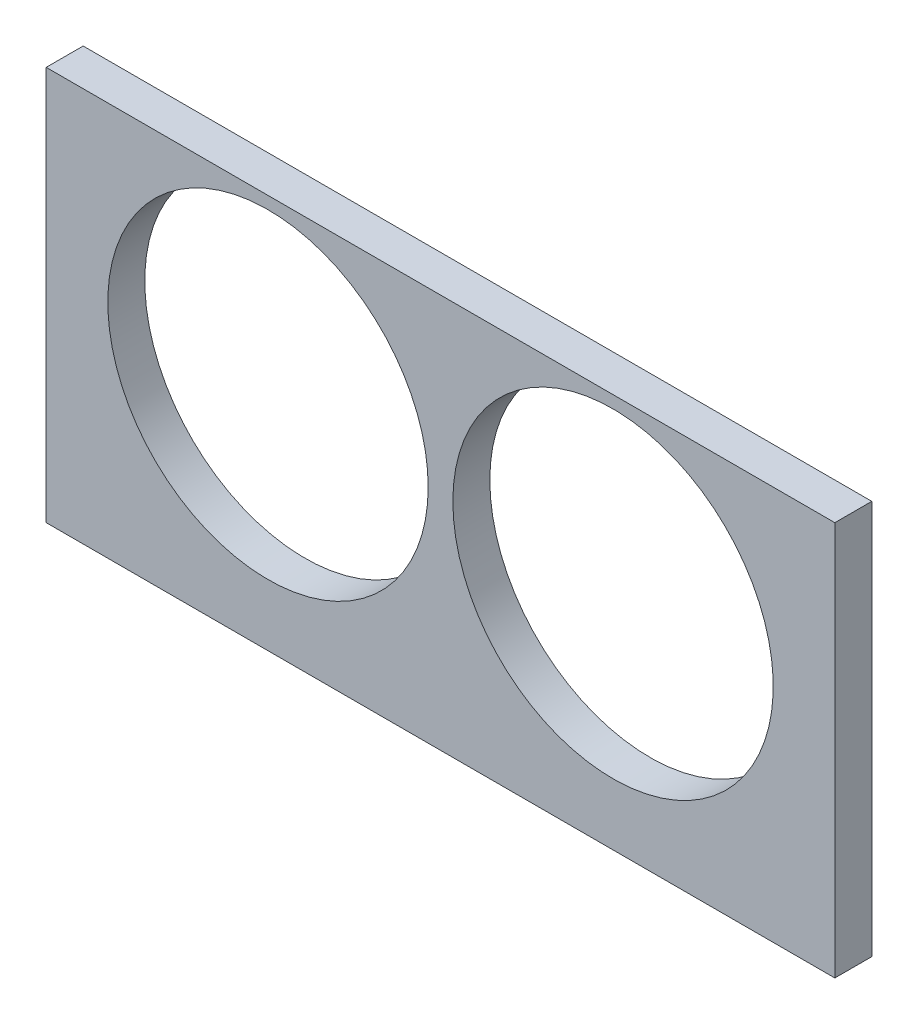
from build123d import *

# Parameters (mm, degrees)
SKETCH1_W           = 32
SKETCH1_H           = 16
SKETCH1_R           = 6.5
BOSS_EXTRUDE1_DEPTH = 1.5


with BuildPart() as part:
    # Sketch1 → Boss-Extrude1 (new body)
    with BuildSketch(Plane.XY):
        with Locations((16, 8)):
            Rectangle(SKETCH1_W, SKETCH1_H)
        with Locations((9, 9)):
            Circle(SKETCH1_R, mode=Mode.SUBTRACT)
        with Locations((23, 9)):
            Circle(SKETCH1_R, mode=Mode.SUBTRACT)
    extrude(amount=BOSS_EXTRUDE1_DEPTH)


solid = part.part
